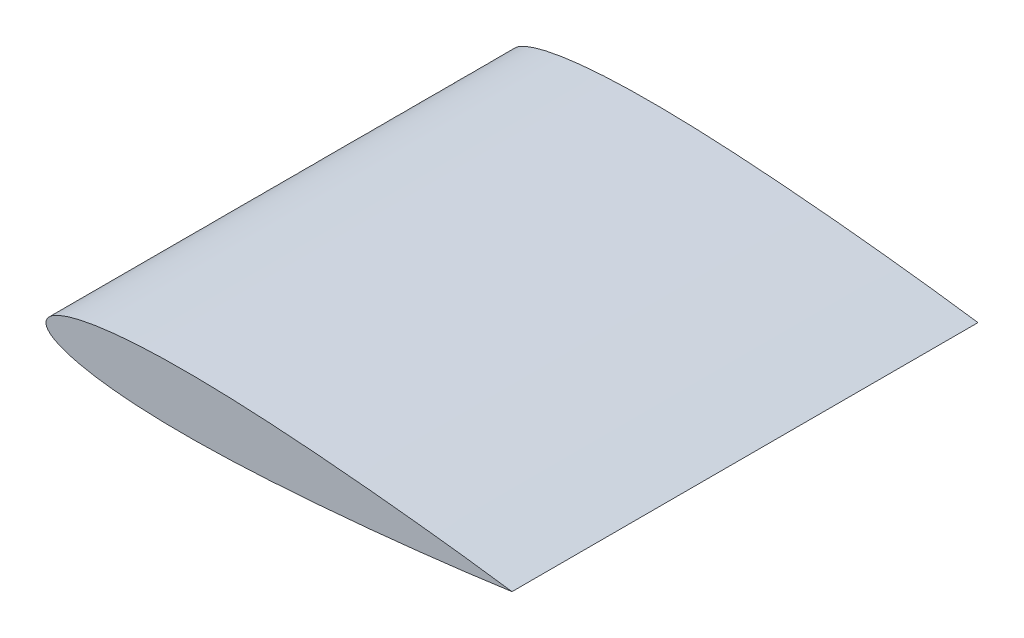
from build123d import *

# Parameters (mm, degrees)
BOSS_EXTRUDE1_DEPTH = 0.5
SCALE1_SCALE        = 1000
BOSS_EXTRUDE2_DEPTH = 500


with BuildPart() as part:
    # Sketch1 → Boss-Extrude1 (new, symmetric)
    with BuildSketch(Plane(origin=(0, 0, 0), x_dir=(-1, 0, 0), z_dir=(0, 0, -1))):
        with BuildLine():
            add(Edge.make_bspline(
                [(0, 0), (-5.5e-08, 0.000888466), (0.000147782, 0.002843842), (0.000947089, 0.006041247), (0.002941878, 0.009713487), (0.006774101, 0.014457085), (0.012556949, 0.019216186), (0.021110429, 0.024428475), (0.034866193, 0.03059158), (0.055431204, 0.037455368), (0.089828348, 0.04550977), (0.139755341, 0.052902373), (0.203428826, 0.057926975), (0.27656322, 0.060001118), (0.353340263, 0.059233405), (0.429257805, 0.056493131), (0.506378652, 0.05199658), (0.581338667, 0.046568611), (0.659622586, 0.039668579), (0.732235268, 0.032719991), (0.813983542, 0.023695093), (0.880399061, 0.016071042), (0.949075665, 0.007054301), (0.982784205, 0.002442523), (1, 0)],
                knots=[0, 0, 0, 0, 0, 0.003158851, 0.007000711, 0.011625702, 0.014778643, 0.02484247, 0.03354265, 0.047310358, 0.068440823, 0.102185964, 0.159338811, 0.227557949, 0.295777086, 0.363996223, 0.432215362, 0.5004345, 0.568653639, 0.636872777, 0.705091915, 0.773311052, 0.84153019, 0.90974933, 0.90974933, 0.90974933, 0.90974933, 0.90974933], degree=4))
            add(Edge.make_bspline(
                [(0, 0), (-5.5e-08, -0.000888466), (0.000147782, -0.002843842), (0.000947089, -0.006041247), (0.002941878, -0.009713487), (0.006774101, -0.014457085), (0.012556949, -0.019216186), (0.021110429, -0.024428475), (0.034866193, -0.03059158), (0.055431204, -0.037455368), (0.089828348, -0.04550977), (0.139755341, -0.052902373), (0.203428826, -0.057926975), (0.27656322, -0.060001118), (0.353340263, -0.059233405), (0.429257805, -0.056493131), (0.506378652, -0.05199658), (0.581338667, -0.046568611), (0.659622586, -0.039668579), (0.732235268, -0.032719991), (0.813983542, -0.023695093), (0.880399061, -0.016071042), (0.949075665, -0.007054301), (0.982784205, -0.002442523), (1, 0)],
                knots=[0, 0, 0, 0, 0, 0.003158851, 0.007000711, 0.011625702, 0.014778643, 0.02484247, 0.03354265, 0.047310358, 0.068440823, 0.102185964, 0.159338811, 0.227557949, 0.295777086, 0.363996223, 0.432215362, 0.5004345, 0.568653639, 0.636872777, 0.705091915, 0.773311052, 0.84153019, 0.90974933, 0.90974933, 0.90974933, 0.90974933, 0.90974933], degree=4))
        make_face()
    extrude(amount=BOSS_EXTRUDE1_DEPTH, both=True)


with BuildPart() as part_1:
    # Scale1: scaled about (0, 0, 0)
    add(part.part.scale(SCALE1_SCALE))


with BuildPart() as body_2:
    # Mirror2: mirrored copy
    add(part_1.part.mirror(Plane(origin=(0, 0, 0), x_dir=(0, 0, 1), z_dir=(1, 0, 0))))


with BuildPart() as body_2_1:
    # Body-Move/Copy1: moved
    add(body_2.part.moved(Location((-500, 0, 0))))


with BuildPart() as body_2_2:
    # Sketch2 → Boss-Extrude2 (new, symmetric)
    with BuildSketch(Plane.XY):
        with BuildLine():
            Line((-500, 0), (499.999999999, 0))
            add(Edge.make_bspline(
                [(-500, 0), (-500, 2.729143553), (-498.552914825, 7.87746422), (-491.629941361, 16.545114127), (-479.122173433, 24.527625243), (-462.412321653, 31.575187473), (-444.028410052, 37.302030756), (-426.206094078, 41.637646557), (-408.636581757, 45.13590403), (-390.865525783, 48.112236804), (-372.845790437, 50.603809178), (-353.706136624, 52.79756667), (-335.23874078, 54.54008429), (-317.458643381, 55.901391882), (-300.283761227, 56.984916097), (-284.923773709, 57.762749856), (-269.271105407, 58.391877796), (-255.059738351, 58.836899016), (-239.449893825, 59.188785153), (-222.361063481, 59.428249609), (-203.622437805, 59.515752946), (-183.15640077, 59.426662715), (-162.293526257, 59.156847128), (-141.721307702, 58.723113117), (-123.043288252, 58.200265637), (-105.639778991, 57.613528958), (-85.007555134, 56.807077565), (-64.772738412, 55.876374347), (-43.034562143, 54.749175473), (-25.067653556, 53.733648434), (-5.520937849, 52.544567115), (16.638868253, 51.112059695), (40.377203548, 49.460215022), (64.552069033, 47.653229583), (86.14154609, 45.946909644), (106.49803493, 44.256204213), (128.85582388, 42.326719839), (151.444570713, 40.307222639), (175.381684614, 38.092855766), (198.719448638, 35.863465989), (222.505252537, 33.500166), (246.439522769, 31.021020054), (267.41224565, 28.776492222), (286.946720832, 26.641503003), (306.191309338, 24.504802187), (325.857518486, 22.282320161), (345.173470641, 20.052010571), (363.428663497, 17.888002774), (383.305664313, 15.461241947), (402.496553061, 13.049348464), (421.518410795, 10.60398483), (439.707148711, 8.225972444), (457.574132153, 5.850049692), (477.941847603, 3.091004194), (491.593896646, 1.192932581), (499.999999999, 0)],
                knots=[0, 0, 0, 0, 0.007609757, 0.015628732, 0.031916707, 0.050723051, 0.06893831, 0.088516617, 0.104682634, 0.121651163, 0.141538763, 0.158212402, 0.178345294, 0.196126237, 0.210690839, 0.228990908, 0.241387606, 0.25679386, 0.270835176, 0.287339018, 0.307091039, 0.325983184, 0.347571032, 0.368495401, 0.386540662, 0.402562153, 0.41974328, 0.447307973, 0.462175995, 0.483805184, 0.500269211, 0.519808766, 0.549158078, 0.570300285, 0.591154345, 0.612894471, 0.630416127, 0.657198455, 0.679638789, 0.701164428, 0.726194707, 0.749985536, 0.771980348, 0.788270401, 0.807818365, 0.828965708, 0.846516972, 0.865043388, 0.883067309, 0.905449804, 0.921966885, 0.939509827, 0.959435293, 0.975012745, 1, 1, 1, 1], degree=3))
        make_face()
    extrude(amount=BOSS_EXTRUDE2_DEPTH, both=True)

    # Mirror3: body 2 2 across plane


with BuildPart() as body_2_2_1:
    add(body_2_2.part)
    add(body_2_2.part.mirror(Plane.ZX))


solid = body_2_2_1.part
